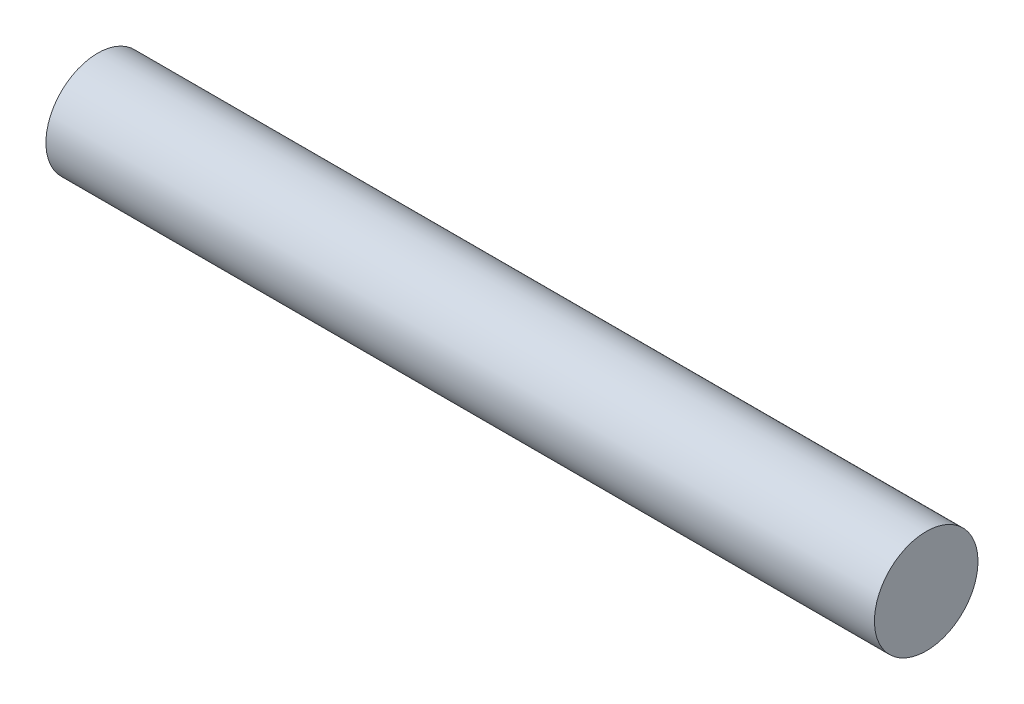
from build123d import *

# Parameters (mm, degrees)
SKETCH1_R           = 1
BOSS_EXTRUDE1_DEPTH = 8


with BuildPart() as part:
    # Sketch1 → Boss-Extrude1 (new, symmetric)
    with BuildSketch(Plane(origin=(0, 0, 0), x_dir=(0, 0, -1), z_dir=(1, 0, 0))):
        Circle(SKETCH1_R)
    extrude(amount=BOSS_EXTRUDE1_DEPTH, both=True)


solid = part.part
